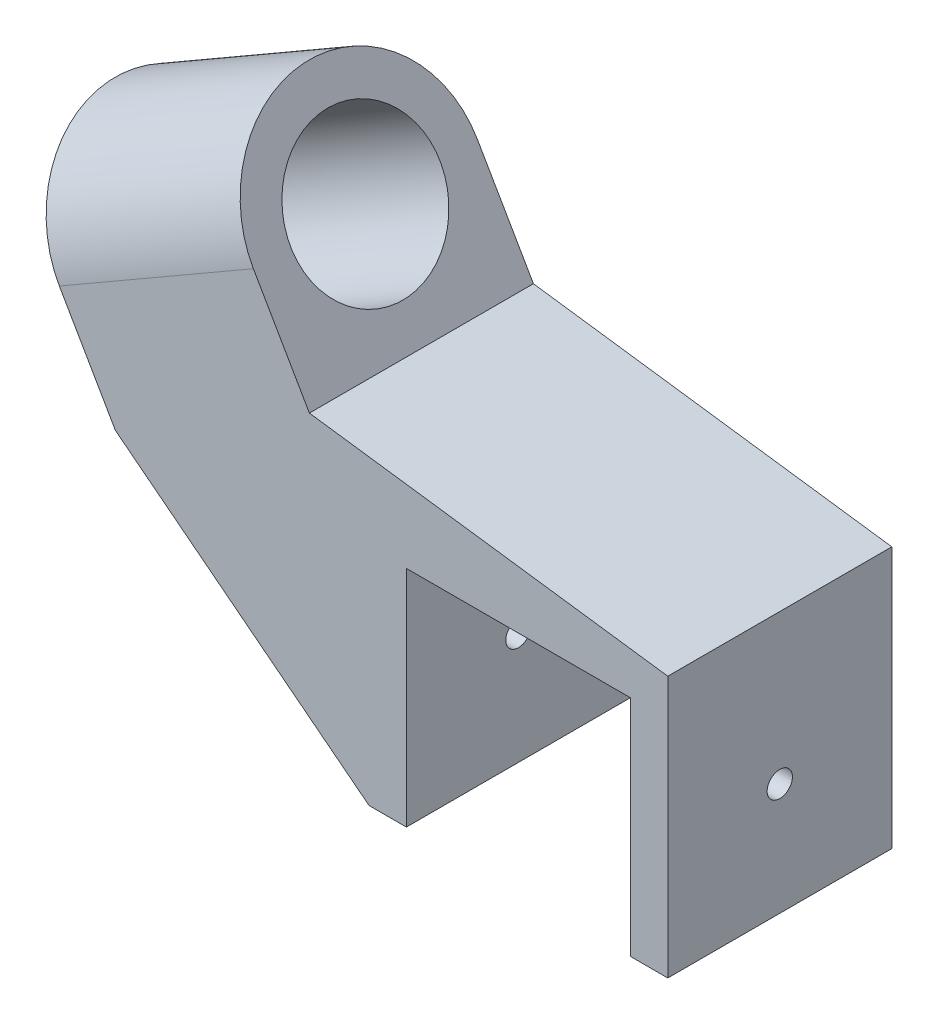
from build123d import *

# Parameters (mm, degrees)
BOSS_EXTRUDE1_DEPTH = 38.1
CUT_EXTRUDE1_DEPTH  = 93.70949475
SKETCH12_W          = 2.150000018
SKETCH12_H          = 50.8
SKETCH14_W          = 3.499999985
SKETCH14_H          = 62.193351826
HOLE3_D             = 25.4


with BuildPart() as part:
    # Sketch7 → Boss-Extrude1 (new body)
    with BuildSketch(Plane.XY):
        Polygon((25.4, 0), (-35.547783942, 8.279432116), (-54.597783942, 41.275), (-87.593351826, 22.225), (-68.543351826, -10.770567884), (-25.4, -44.45), (-19.05, -44.45), (-19.05, -6.35), (19.05, -6.35), (19.05, -44.45), (25.4, -44.45), align=None)
    extrude(amount=BOSS_EXTRUDE1_DEPTH)

    # Sketch8 → Cut-Extrude1 (cut, through all)
    with BuildSketch(Plane(origin=(-23.075738686, -13.322783942, 0), x_dir=(0, 0, -1), z_dir=(0.8660254037844413, 0.4999999999999956, 0))):
        with BuildLine():
            ThreePointArc((-38.1, 43.994090512), (-32.520384182, 57.464474694), (-19.05, 63.044090512))
            Line((-19.05, 63.044090512), (-38.1, 63.044090512))
            Line((-38.1, 63.044090512), (-38.1, 43.994090512))
        make_face()
        with BuildLine():
            Line((0, 43.994090512), (0, 63.044090512))
            Line((0, 63.044090512), (-19.05, 63.044090512))
            ThreePointArc((-19.05, 63.044090512), (-5.579615818, 57.464474694), (0, 43.994090512))
        make_face()
    extrude(amount=-CUT_EXTRUDE1_DEPTH, mode=Mode.SUBTRACT)

    # Sketch12 → Hole1 (revolve, cut)
    with BuildSketch(Plane(origin=(-25.4, -25.4, 19.05), x_dir=(0, 0, 1), z_dir=(0, 1, 0))):
        with Locations((1.075000009, 25.4)):
            Rectangle(SKETCH12_W, SKETCH12_H)
    revolve(axis=Axis((84.6, -25.4, 19.05), (-1, 0, 0)), mode=Mode.SUBTRACT)

    # Sketch14 → Hole2 (revolve, cut)
    with BuildSketch(Plane(origin=(-25.4, -25.4, 19.05), x_dir=(0, 0, -1), z_dir=(0, 1, 0))):
        with Locations((1.749999993, 31.096675913)):
            Rectangle(SKETCH14_W, SKETCH14_H)
    revolve(axis=Axis((-135.4, -25.4, 19.05), (1, 0, 0)), mode=Mode.SUBTRACT)

    # Hole3 (through all)
    with Locations(Plane(origin=(-23.075738686, -13.322783942, 0), x_dir=(0, 0, -1), z_dir=(0.8660254037844412, 0.4999999999999956, 0))):
        with Locations((-19.05, 43.994090512)):
            Hole(HOLE3_D / 2)


solid = part.part
